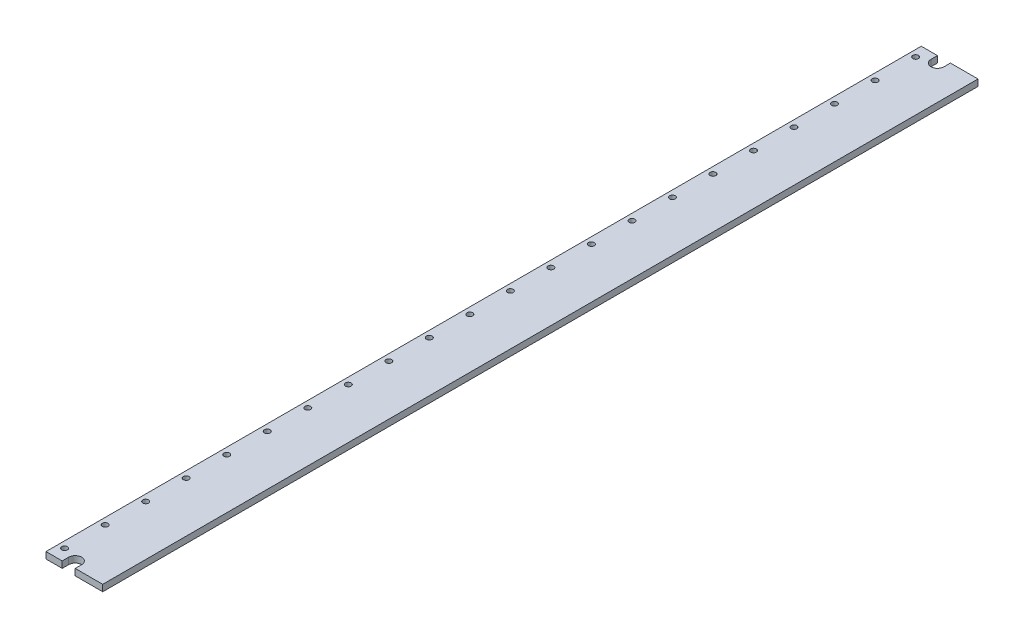
from build123d import *

# Parameters (mm, degrees)
SKETCH1_W           = 35
SKETCH1_H           = 4
BOSS_EXTRUDE2_DEPTH = 540
SKETCH2_R           = 1.75
CUT_EXTRUDE1_DEPTH  = 541.29829724
LPATTERN1_COUNT     = 22
LPATTERN1_PITCH     = 25
CUT_EXTRUDE2_REACH  = 542.298


with BuildPart() as part:
    # Sketch1 → Boss-Extrude2 (new body)
    with BuildSketch(Plane.XY):
        Rectangle(SKETCH1_W, SKETCH1_H)
    extrude(amount=BOSS_EXTRUDE2_DEPTH)

    # Sketch2 → Cut-Extrude1 (cut, through all)
    with BuildSketch(Plane(origin=(0, 2, 0), x_dir=(1, 0, 0), z_dir=(0, 1, 0))):
        with Locations((-13.5, -7.5)):
            Circle(SKETCH2_R)
    cut_extrude1 = extrude(amount=-CUT_EXTRUDE1_DEPTH, mode=Mode.SUBTRACT)

    # LPattern1: Cut-Extrude1 ×22
    with Locations(*[(0, 0, i * LPATTERN1_PITCH) for i in range(1, LPATTERN1_COUNT)]):
        add(cut_extrude1, mode=Mode.SUBTRACT)

    # Sketch3 → Cut-Extrude2 (cut, up to next)
    with BuildSketch(Plane(origin=(0, 2, 0), x_dir=(1, 0, 0), z_dir=(0, 1, 0)), mode=Mode.PRIVATE) as cut_extrude2_sk1:
        with BuildLine():
            Line((-7.5, 0), (-7.5, -4))
            ThreePointArc((-7.5, -4), (-3.5, -8), (0.5, -4))
            Line((0.5, -4), (0.5, 0))
            Line((0.5, 0), (-7.5, 0))
        make_face()
    cut_extrude2_tool1 = extrude(cut_extrude2_sk1.sketch, amount=-CUT_EXTRUDE2_REACH, mode=Mode.PRIVATE) & part.part
    # Sketch3 → Cut-Extrude2 (cut, up to next)
    with BuildSketch(Plane(origin=(0, 2, 0), x_dir=(1, 0, 0), z_dir=(0, 1, 0)), mode=Mode.PRIVATE) as cut_extrude2_sk2:
        with BuildLine():
            Line((-7.5, -540), (-7.5, -536))
            ThreePointArc((-7.5, -536), (-3.5, -532), (0.5, -536))
            Line((0.5, -536), (0.5, -540))
            Line((0.5, -540), (-7.5, -540))
        make_face()
    cut_extrude2_tool2 = extrude(cut_extrude2_sk2.sketch, amount=-CUT_EXTRUDE2_REACH, mode=Mode.PRIVATE) & part.part
    add(cut_extrude2_tool1.solids().sort_by_distance((-3.5, 2, 3.626601))[0], mode=Mode.SUBTRACT)
    add(cut_extrude2_tool2.solids().sort_by_distance((-3.5, 2, 536.373399))[0], mode=Mode.SUBTRACT)


solid = part.part
